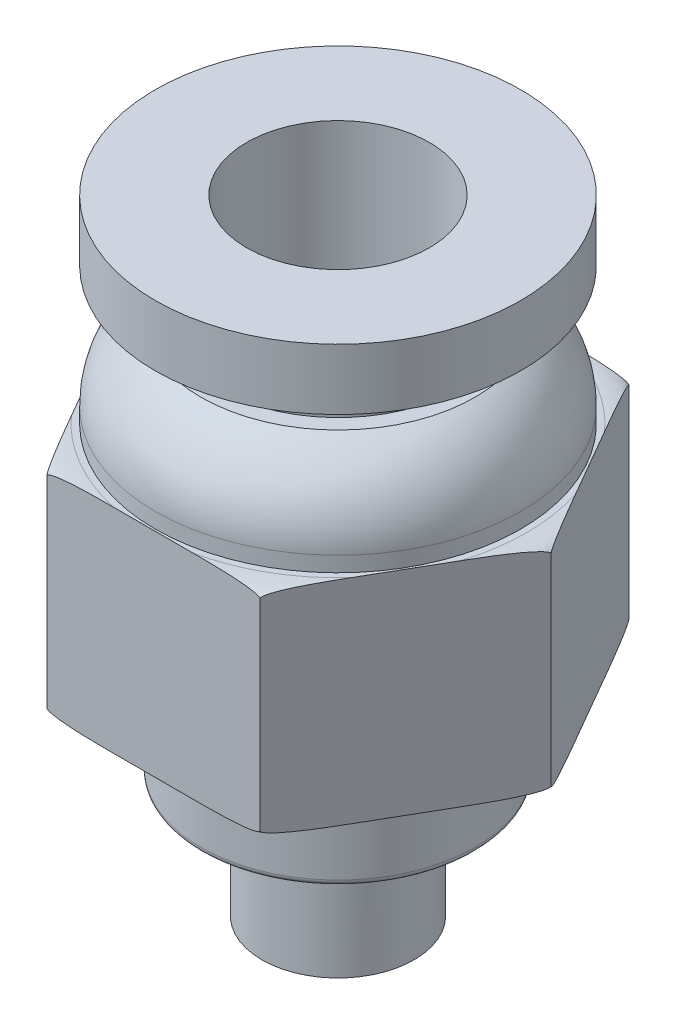
from build123d import *

# Parameters (mm, degrees)
FILLET_1_SIZE       = 0.8
FILLET_1_SIZE_2     = 0.2
SKETCH_3_R          = 12
CUT_EXTRUDE_3_DEPTH = 23.765104937
EXTRUDE_START       = 3
SKETCH_4_R          = 4.5
SKETCH_4_R_2        = 2.5
EXTRUDE_1_DEPTH     = 3
SKETCH_5_R          = 1
CUT_EXTRUDE_4_DEPTH = 8.5
FILLET_2_R          = 0.2


with BuildPart() as part:
    # 草图1 → 旋转1 (revolve)
    with BuildSketch(Plane.XY, mode=Mode.PRIVATE) as revolve_1_sk:
        with BuildLine():
            ThreePointArc((4.5, 17), (5.596229956, 15.957737974), (6, 14.5))
            Line((6, 14.5), (6, 14))
            Line((6, 14), (7, 14))
            Line((7, 14), (7, 7))
            Line((7, 7), (2.5, 7))
            Line((2.5, 7), (2.5, 0))
            Line((2.5, 0), (0, 0))
            Line((0, 0), (0, 8.5))
            Line((0, 8.5), (3, 8.5))
            Line((3, 8.5), (3, 20.5))
            Line((3, 20.5), (6, 20.5))
            Line((6, 20.5), (6, 18.5))
            Line((6, 18.5), (3.5, 18.5))
            Line((3.5, 18.5), (3.5, 17.5))
            Line((3.5, 17.5), (4, 17.5))
            Line((4, 17.5), (4, 17))
            Line((4, 17), (4.5, 17))
        make_face()
    revolve(revolve_1_sk.sketch.rotate(Axis((0, 26.759420291, 0), (0, -1, 0)), 90), axis=Axis((0, 26.759420291, 0), (0, -1, 0)))

    # 圆角1
    # an asymmetric fillet: 0.8, 0.2 mm, written as the material it takes off along each edge
    with BuildSketch(Plane(origin=(0, 14, 0), x_dir=(0, 0, 1), z_dir=(1, 0, 0))) as fillet_1_piece_1:
        with BuildLine():
            Bezier((7 - FILLET_1_SIZE, 0), (7, 0), (7, FILLET_1_SIZE_2), weights=[1, 0.707106781, 1])
            Line((7, FILLET_1_SIZE_2), (7, 0))
            Line((7, 0), (7 - FILLET_1_SIZE, 0))
        make_face()
    revolve(axis=Axis((0, 14, 0), (0, -1, 0)), mode=Mode.SUBTRACT)
    with BuildSketch(Plane(origin=(0, 7, 0), x_dir=(0, 0, 1), z_dir=(1, 0, 0))) as fillet_1_piece_2:
        with BuildLine():
            Bezier((7, -FILLET_1_SIZE_2), (7, 0), (7 - FILLET_1_SIZE, 0), weights=[1, 0.707106781, 1])
            Line((7 - FILLET_1_SIZE, 0), (7, 0))
            Line((7, 0), (7, -FILLET_1_SIZE_2))
        make_face()
    revolve(axis=Axis((0, 7, 0), (0, -1, 0)), mode=Mode.SUBTRACT)

    # 草图3 → 切除-拉伸3 (cut, through all)
    with BuildSketch(Plane(origin=(0, 0, 0), x_dir=(1, 0, 0), z_dir=(0, 1, 0))):
        Circle(SKETCH_3_R)
        Polygon((7, 0), (3.5, 6.062177826), (-3.5, 6.062177826), (-7, 0), (-3.5, -6.062177826), (3.5, -6.062177826), align=None, mode=Mode.SUBTRACT)
    extrude(amount=CUT_EXTRUDE_3_DEPTH, mode=Mode.SUBTRACT)

    # 草图4 → 凸台-拉伸1 (add)
    with BuildSketch(Plane.XZ.offset(-7).offset(EXTRUDE_START)):
        with Locations(Location((0, 0, 0), (0, 0, 270))):
            Circle(SKETCH_4_R)
        with Locations(Location((0, 0, 0), (0, 0, 90))):
            Circle(SKETCH_4_R_2, mode=Mode.SUBTRACT)
    extrude(amount=-EXTRUDE_1_DEPTH)

    # 草图5 → 切除-拉伸4 (cut)
    with BuildSketch(Plane.XZ):
        with Locations(Location((0, 0, 0), (0, 0, 270))):
            Circle(SKETCH_5_R)
    extrude(amount=-CUT_EXTRUDE_4_DEPTH, mode=Mode.SUBTRACT)

    # 圆角2
    fillet_2_edges = [part.edges().sort_by_distance(p)[0] for p in [
        (0, 4, 4.5),
    ]]
    fillet(fillet_2_edges, radius=FILLET_2_R)


solid = part.part
